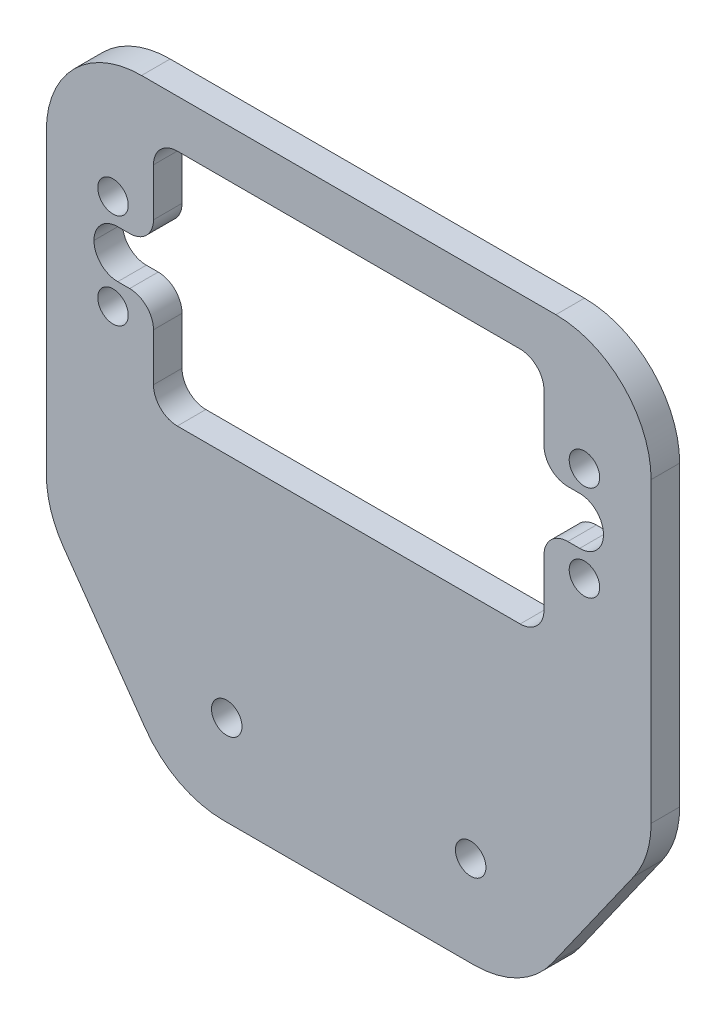
from build123d import *

# Parameters (mm, degrees)
ESBO_O1_R                = 1.6
RESSALTO_EXTRUS_O1_DEPTH = 3
FILETE1_R                = 10
FILETE2_START            = -1
FILETE2_DEPTH            = 5
FILETE2_2_DEPTH          = 3


with BuildPart() as part:
    # Esboço1 → Ressalto-extrusão1 (new body)
    with BuildSketch(Plane.XY):
        Polygon((-31.75, -26.93380815), (-18.341364608, -45.93380815), (18.341364608, -45.93380815), (31.75, -26.93380815), (31.75, 17.5), (-31.75, 17.5), align=None)
        with Locations((-12.806248475, -36.43380815)):
            Circle(ESBO_O1_R, mode=Mode.SUBTRACT)
        with Locations((12.806248475, -36.43380815)):
            Circle(ESBO_O1_R, mode=Mode.SUBTRACT)
        with Locations((-24.75, -5)):
            Circle(ESBO_O1_R, mode=Mode.SUBTRACT)
        with Locations((-24.75, 5)):
            Circle(ESBO_O1_R, mode=Mode.SUBTRACT)
        with BuildLine():
            Line((-18, 12.5), (18, 12.5))
            ThreePointArc((18, 12.5), (19.767766953, 11.767766953), (20.5, 10))
            Line((20.5, 10), (20.5, 2.5))
            Line((20.5, 2.5), (26.75, 2.5))
            Line((26.75, 2.5), (26.75, -2.5))
            Line((26.75, -2.5), (20.5, -2.5))
            Line((20.5, -2.5), (20.5, -10))
            ThreePointArc((20.5, -10), (19.767766953, -11.767766953), (18, -12.5))
            Line((18, -12.5), (-18, -12.5))
            ThreePointArc((-18, -12.5), (-19.767766953, -11.767766953), (-20.5, -10))
            Line((-20.5, -10), (-20.5, -2.5))
            Line((-20.5, -2.5), (-26.75, -2.5))
            Line((-26.75, -2.5), (-26.75, 2.5))
            Line((-26.75, 2.5), (-20.5, 2.5))
            Line((-20.5, 2.5), (-20.5, 10))
            ThreePointArc((-20.5, 10), (-19.767766953, 11.767766953), (-18, 12.5))
        make_face(mode=Mode.SUBTRACT)
        with Locations((24.75, -5)):
            Circle(ESBO_O1_R, mode=Mode.SUBTRACT)
        with Locations((24.75, 5)):
            Circle(ESBO_O1_R, mode=Mode.SUBTRACT)
    extrude(amount=RESSALTO_EXTRUS_O1_DEPTH)

    # Filete1
    filete1_edges = [part.edges().sort_by_distance(p)[0] for p in [
        (-31.75, 17.5, 1.5),
        (31.75, 17.5, 1.5),
        (31.75, -26.93380815, 1.5),
        (18.341364608, -45.93380815, 1.5),
        (-18.341364608, -45.93380815, 1.5),
        (-31.75, -26.93380815, 1.5),
    ]]
    fillet(filete1_edges, radius=FILETE1_R)

    # Filete2: read off the stored shape, not the designer's step
    # Filete2 outline → Filete2 (cut)
    with BuildSketch(Plane.XY.offset(FILETE2_START)):
        with BuildLine():
            Line((-20.5, -2.5), (-23, -2.5))
            ThreePointArc((-23, -2.5), (-21.232233047, -3.232233047), (-20.5, -5))
            Line((-20.5, -5), (-20.5, -2.5))
        make_face()
        with BuildLine():
            ThreePointArc((-20.5, 5), (-21.232233047, 3.232233047), (-23, 2.5))
            Line((-23, 2.5), (-20.5, 2.5))
            Line((-20.5, 2.5), (-20.5, 5))
        make_face()
        with BuildLine():
            Line((20.5, -2.5), (20.5, -5))
            ThreePointArc((20.5, -5), (21.232233047, -3.232233047), (23, -2.5))
            Line((23, -2.5), (20.5, -2.5))
        make_face()
        with BuildLine():
            Line((20.5, 2.5), (23, 2.5))
            ThreePointArc((23, 2.5), (21.232233047, 3.232233047), (20.5, 5))
            Line((20.5, 5), (20.5, 2.5))
        make_face()
    extrude(amount=FILETE2_DEPTH, mode=Mode.SUBTRACT)

    # Filete2 2 outline → Filete2 2 (add)
    with BuildSketch(Plane.XY):
        with BuildLine():
            ThreePointArc((-24.25, -2.5), (-26.017766953, -1.767766953), (-26.75, 0))
            Line((-26.75, 0), (-26.75, -2.5))
            Line((-26.75, -2.5), (-24.25, -2.5))
        make_face()
        with BuildLine():
            ThreePointArc((-26.75, 0), (-26.017766953, 1.767766953), (-24.25, 2.5))
            Line((-24.25, 2.5), (-26.75, 2.5))
            Line((-26.75, 2.5), (-26.75, 0))
        make_face()
        with BuildLine():
            ThreePointArc((24.25, 2.5), (26.017766953, 1.767766953), (26.75, 0))
            Line((26.75, 0), (26.75, 2.5))
            Line((26.75, 2.5), (24.25, 2.5))
        make_face()
        with BuildLine():
            ThreePointArc((26.75, 0), (26.017766953, -1.767766953), (24.25, -2.5))
            Line((24.25, -2.5), (26.75, -2.5))
            Line((26.75, -2.5), (26.75, 0))
        make_face()
    extrude(amount=FILETE2_2_DEPTH)


solid = part.part
